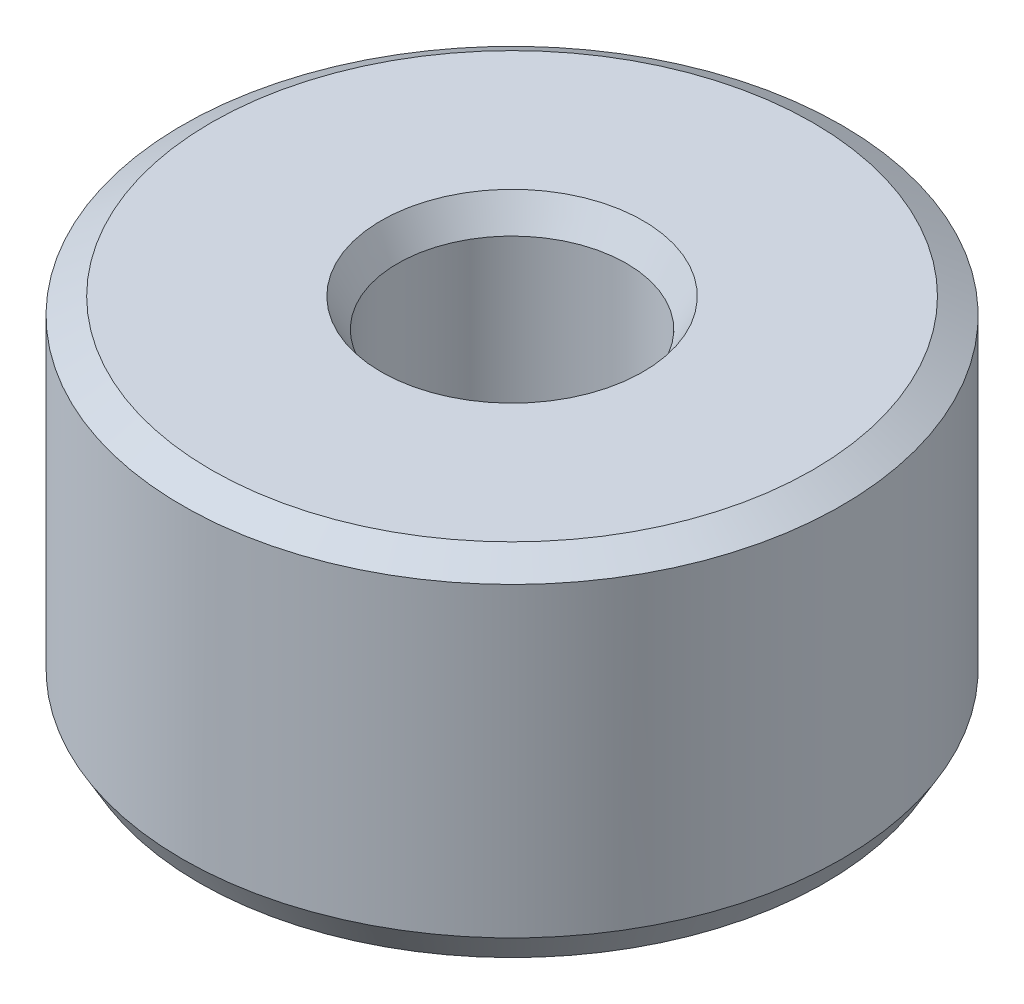
from build123d import *
from OCP.BRepFilletAPI import BRepFilletAPI_MakeChamfer

# Parameters (mm, degrees)
SKETCH1_R           = 12.5
BOSS_EXTRUDE1_DEPTH = 13.330483146
SKETCH2_R           = 4.339231065
CUT_EXTRUDE1_DEPTH  = 23.140500918
CHAMFER1_SIZE       = 0.629618649
CHAMFER1_SIZE2      = 1.09053149


with BuildPart() as part:
    # Sketch1 → Boss-Extrude1 (new body)
    with BuildSketch(Plane(origin=(0, 0, 0), x_dir=(1, 0, 0), z_dir=(0, 1, 0))):
        Circle(SKETCH1_R)
    extrude(amount=BOSS_EXTRUDE1_DEPTH)

    # Sketch2 → Cut-Extrude1 (cut, through all)
    with BuildSketch(Plane(origin=(0, 0, 0), x_dir=(1, 0, 0), z_dir=(0, 1, 0))):
        Circle(SKETCH2_R)
    extrude(amount=CUT_EXTRUDE1_DEPTH, mode=Mode.SUBTRACT)

    # Chamfer1: one chamfer whose edges measure the first distance from different faces: ONE call of the kernel's chamfer builder (chamfer() names one face for all edges)
    chamfer1_edges_1 = [part.edges().sort_by_distance(p)[0] for p in [
        (-4.339231065, 13.330483146, 0),
    ]]
    chamfer1_side_1 = [part.faces().sort_by_distance(p)[0] for p in [
        (-12.146446609, 13.330483146, 0),
    ]]
    chamfer1_edges_2 = [part.edges().sort_by_distance(p)[0] for p in [
        (-4.339231065, 0, 0),
    ]]
    chamfer1_side_2 = [part.faces().sort_by_distance(p)[0] for p in [
        (-4.339231065, 6.665241573, 0),
    ]]
    chamfer1_edges_3 = [part.edges().sort_by_distance(p)[0] for p in [
        (-12.5, 0, 0),
    ]]
    chamfer1_side_3 = [part.faces().sort_by_distance(p)[0] for p in [
        (-12.146446609, 0, 0),
    ]]
    chamfer1_edges_4 = [part.edges().sort_by_distance(p)[0] for p in [
        (-12.5, 13.330483146, 0),
    ]]
    chamfer1_side_4 = [part.faces().sort_by_distance(p)[0] for p in [
        (-12.5, 6.665241573, 0),
    ]]
    chamfer1 = BRepFilletAPI_MakeChamfer(part.part.solid().wrapped)
    for e in chamfer1_edges_1:
        chamfer1.Add(CHAMFER1_SIZE, CHAMFER1_SIZE2, e.wrapped, chamfer1_side_1[0].wrapped)  # the first distance lies on this face
    for e in chamfer1_edges_2:
        chamfer1.Add(CHAMFER1_SIZE, CHAMFER1_SIZE2, e.wrapped, chamfer1_side_2[0].wrapped)  # the first distance lies on this face
    for e in chamfer1_edges_3:
        chamfer1.Add(CHAMFER1_SIZE, CHAMFER1_SIZE2, e.wrapped, chamfer1_side_3[0].wrapped)  # the first distance lies on this face
    for e in chamfer1_edges_4:
        chamfer1.Add(CHAMFER1_SIZE, CHAMFER1_SIZE2, e.wrapped, chamfer1_side_4[0].wrapped)  # the first distance lies on this face
    add(Compound.cast(chamfer1.Shape()), mode=Mode.REPLACE)


solid = part.part
